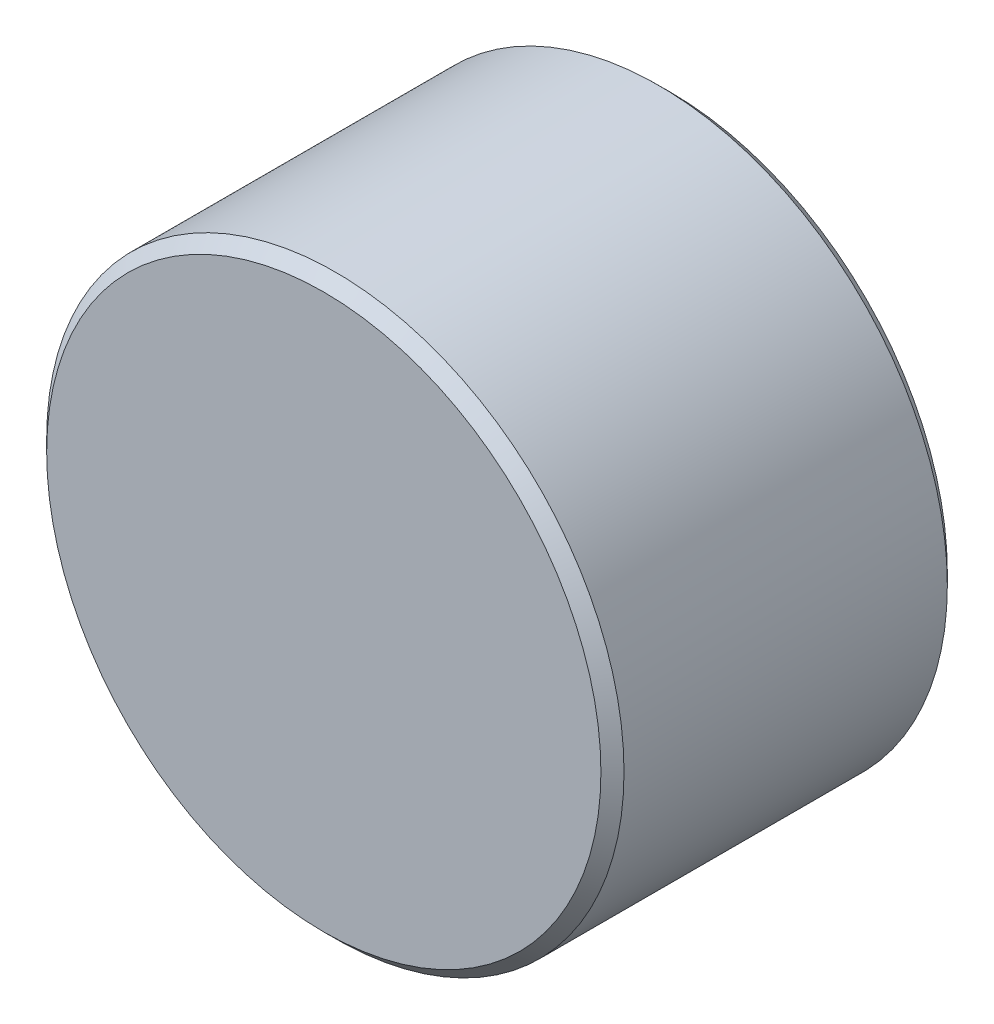
from build123d import *

# Parameters (mm, degrees)
SKETCH1_R           = 2.5
BOSS_EXTRUDE1_DEPTH = 3
CHAMFER1_SIZE       = 0.1


with BuildPart() as part:
    # Sketch1 → Boss-Extrude1 (new body)
    with BuildSketch(Plane.XY):
        Circle(SKETCH1_R)
    extrude(amount=BOSS_EXTRUDE1_DEPTH)

    # Chamfer1
    chamfer1_edges = [part.edges().sort_by_distance(p)[0] for p in [
        (-2.5, 0, 0),
        (-2.5, 0, 3),
    ]]
    chamfer(chamfer1_edges, length=CHAMFER1_SIZE)


solid = part.part
